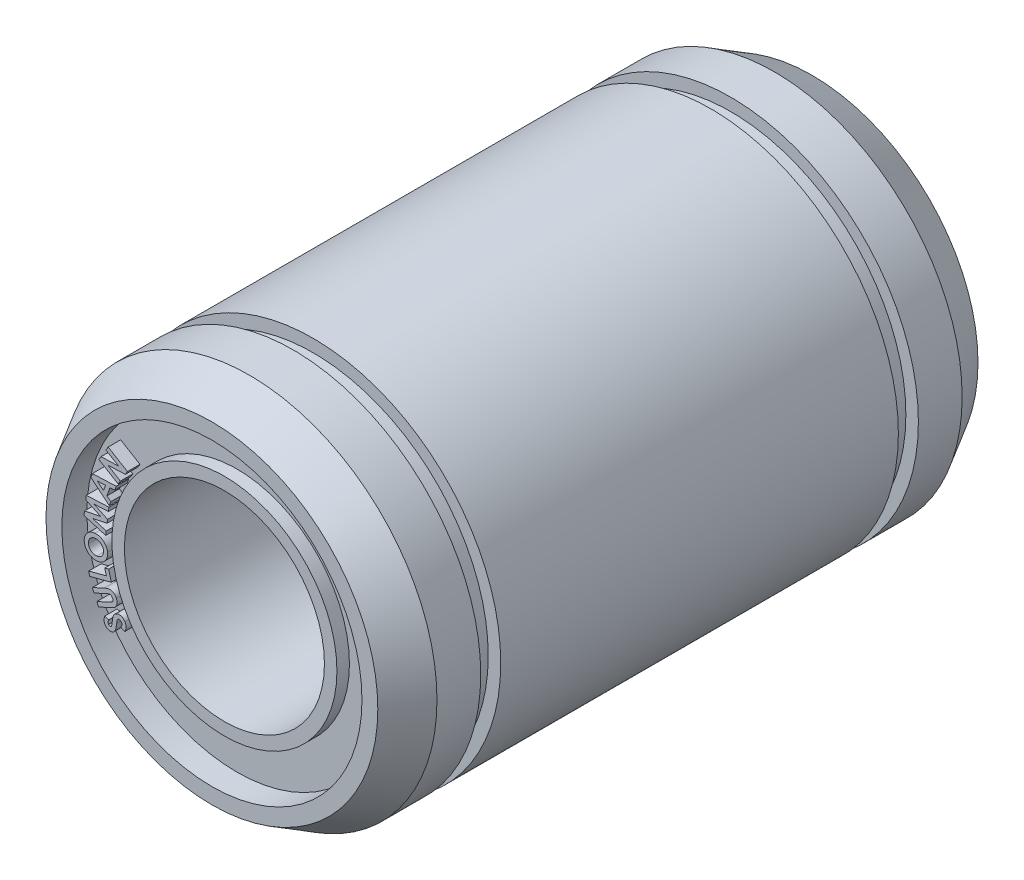
from build123d import *

# Parameters (mm, degrees)
SKETCH1_R                = 7.5
SKETCH1_R_2              = 6
BOSS_EXTRUDE1_DEPTH      = 12
CHAMFER2_SIZE            = 1.5
CHAMFER2_SIZE2           = 0.866025404
BOSS_EXTRUDE2_DEPTH      = 11
BOSS_EXTRUDE2_DEPTH_BACK = 11
SKETCH5_R                = 6
SKETCH5_R_2              = 4
SKETCH6_R                = 4.5
SKETCH6_R_2              = 4
BOSS_EXTRUDE3_DEPTH      = 0.5
SKETCH7_W                = 0.8
SKETCH7_H                = 0.5
BOSS_EXTRUDE4_DEPTH      = 0.5
CHAMFER3_SIZE            = 1.5
CHAMFER3_SIZE2           = 0.866025404


with BuildPart() as part:
    # Sketch1 → Boss-Extrude1 (new, symmetric)
    with BuildSketch(Plane.XY):
        Circle(SKETCH1_R)
        Circle(SKETCH1_R_2, mode=Mode.SUBTRACT)
    extrude(amount=BOSS_EXTRUDE1_DEPTH, both=True)

    # Chamfer2
    chamfer2_edges = [part.edges().sort_by_distance(p)[0] for p in [
        (-7.5, 0, 12),
    ]]
    chamfer2_side = [part.faces().sort_by_distance(p)[0] for p in [
        (-7.5, 0, 0),
    ]]
    chamfer(chamfer2_edges, length=CHAMFER2_SIZE, length2=CHAMFER2_SIZE2, reference=chamfer2_side[0])



with BuildPart() as body_2:
    # Sketch5 → Boss-Extrude2 (new, two sides: drawn at the far end of the back side and taken through both)
    with BuildSketch(Plane.XY.offset(-BOSS_EXTRUDE2_DEPTH_BACK)):
        Circle(SKETCH5_R)
        Circle(SKETCH5_R_2, mode=Mode.SUBTRACT)
    extrude(amount=BOSS_EXTRUDE2_DEPTH + BOSS_EXTRUDE2_DEPTH_BACK)


with BuildPart() as part_1:
    add(part.part)

    add(body_2.part)  # Boss-Extrude3 merges body 2
    # Sketch6 → Boss-Extrude3 (add)
    with BuildSketch(Plane.XY.offset(11)):
        Circle(SKETCH6_R)
        Circle(SKETCH6_R_2, mode=Mode.SUBTRACT)
    boss_extrude3 = extrude(amount=BOSS_EXTRUDE3_DEPTH)

    # Mirror1: Boss-Extrude3 across plane
    add(boss_extrude3.mirror(Plane.XY))

    # Sketch7 → Cut-Revolve1 (revolve, cut)
    with BuildSketch(Plane(origin=(0, 0, 0), x_dir=(0, 0, -1), z_dir=(1, 0, 0))):
        with Locations((-8.35, 7.25)):
            Rectangle(SKETCH7_W, SKETCH7_H)
        with Locations((8.35, 7.25)):
            Rectangle(SKETCH7_W, SKETCH7_H)
    revolve(axis=Axis((0, 0, 0), (0, 0, -1)), mode=Mode.SUBTRACT)

    # Sketch8 → Boss-Extrude4 (add)
    # profile 1 of 7: a face of its own
    with BuildSketch(Plane.XY.offset(11)):
        Polygon((-5.019213926, 2.56696334), (-4.934838926, 2.707408052), (-4.229009599, 2.73336959), (-4.736161041, 3.03805709), (-4.647819695, 3.184811898), (-3.877086522, 2.72165084), (-3.961822099, 2.580665263), (-4.666028829, 2.554523436), (-4.160319695, 2.25055709), (-4.248480752, 2.103802283), align=None)
    # profile 2 of 7: a face of its own
    with BuildSketch(Plane.XY.offset(11)):
        Polygon((-5.335912282, 1.78586355), (-5.281104589, 1.949024608), (-4.326296897, 1.9897698), (-4.382546897, 1.822462108), (-4.578881032, 1.815070281), (-4.694986801, 1.470178454), (-4.54390507, 1.342714512), (-4.600335359, 1.175406819), align=None)
        Polygon((-5.084049301, 1.793255377), (-4.831645455, 1.582858742), (-4.756104589, 1.807498166), align=None, mode=Mode.SUBTRACT)
    # profile 3 of 7: a face of its own
    with BuildSketch(Plane.XY.offset(11)):
        Polygon((-5.614467681, 0.334474611), (-5.594455662, 0.499618842), (-4.951006143, 0.629787111), (-5.544515758, 0.912479419), (-5.524684028, 1.0752799), (-4.619816239, 1.1174674), (-4.639467681, 0.954666919), (-5.210982104, 0.927263073), (-4.673902778, 0.670892881), (-4.691931624, 0.521974611), (-5.274443643, 0.403344804), (-4.726186431, 0.23856115), (-4.746018162, 0.073957785), align=None)
    # profile 4 of 7: a face of its own
    with BuildSketch(Plane.XY.offset(11)):
        with BuildLine():
            add(Edge.make_bspline(
                [(-5.603687751, -0.569841462), (-5.604771213, -0.554405134), (-5.606912505, -0.523897658), (-5.604836323, -0.478508597), (-5.59828654, -0.434375331), (-5.587500583, -0.391434334), (-5.572018329, -0.349792704), (-5.552227666, -0.309321337), (-5.527970554, -0.270163036), (-5.499603183, -0.232735486), (-5.46801183, -0.197899174), (-5.433869548, -0.166445264), (-5.39720005, -0.139279288), (-5.358297061, -0.116022804), (-5.316953038, -0.097101922), (-5.27344981, -0.082048667), (-5.227654972, -0.071116249), (-5.196164785, -0.067200484), (-5.180190155, -0.065214058)],
                knots=[0, 0, 0, 0, 1.013293411, 2.002615178, 2.969929983, 3.932617152, 4.898167076, 5.875568108, 6.879846568, 7.911542323, 8.948552327, 9.957490501, 10.948237499, 11.933530897, 12.921966733, 13.921943731, 14.945824639, 16, 16, 16, 16], degree=3))
            add(Edge.make_bspline(
                [(-5.180190155, -0.065214058), (-5.164273478, -0.064064367), (-5.132930459, -0.061800403), (-5.086362342, -0.063759752), (-5.04126119, -0.069851147), (-4.997576001, -0.080239792), (-4.955530926, -0.095487507), (-4.914737099, -0.114512303), (-4.875636997, -0.138461127), (-4.838306799, -0.166172433), (-4.803561242, -0.197027873), (-4.772554477, -0.230566202), (-4.745498007, -0.266182305), (-4.722630215, -0.304154469), (-4.703816933, -0.344353118), (-4.689061103, -0.386768614), (-4.677976192, -0.431298182), (-4.674221861, -0.46197409), (-4.672317559, -0.47753377)],
                knots=[0, 0, 0, 0, 1.051083948, 2.069787806, 3.065186475, 4.047001297, 5.02295037, 6.008083167, 7.00866935, 8.039292488, 9.068841912, 10.066672639, 11.045005907, 12.011619095, 12.982628744, 13.964723154, 14.967650608, 16, 16, 16, 16], degree=3))
            add(Edge.make_bspline(
                [(-4.672317559, -0.47753377), (-4.671174586, -0.493870455), (-4.668931316, -0.525933852), (-4.670769912, -0.573546861), (-4.677277083, -0.619372172), (-4.688096233, -0.663651894), (-4.703679977, -0.706136439), (-4.723860037, -0.746959035), (-4.748544058, -0.786081785), (-4.777419269, -0.823037218), (-4.80937336, -0.857226715), (-4.843868735, -0.887740214), (-4.88035879, -0.914362069), (-4.918952156, -0.936996103), (-4.959495616, -0.955734288), (-5.002160222, -0.970036057), (-5.046713009, -0.980983345), (-5.077372214, -0.984754616), (-5.092930539, -0.986668385)],
                knots=[0, 0, 0, 0, 1.067921877, 2.095970056, 3.101855708, 4.083271722, 5.064468398, 6.04820796, 7.049037107, 8.077279679, 9.103666541, 10.098115712, 11.077681476, 12.046047685, 13.012753385, 13.986115716, 14.978033957, 16, 16, 16, 16], degree=3))
            add(Edge.make_bspline(
                [(-5.092930539, -0.986668385), (-5.103440225, -0.987549711), (-5.124315146, -0.989300249), (-5.155518994, -0.989084084), (-5.186291796, -0.98739402), (-5.216584291, -0.983569235), (-5.246438089, -0.977877368), (-5.27570031, -0.969780851), (-5.304639777, -0.96008789), (-5.333006568, -0.948400159), (-5.360531237, -0.934916184), (-5.386927267, -0.919758882), (-5.411982678, -0.90293231), (-5.435907526, -0.8847182), (-5.458469147, -0.864750233), (-5.479995132, -0.84338628), (-5.499940642, -0.820123157), (-5.518906818, -0.795761388), (-5.536062918, -0.770115503), (-5.551506137, -0.743637034), (-5.565063126, -0.716437945), (-5.576530972, -0.688431306), (-5.586401303, -0.659880537), (-5.594084129, -0.630511219), (-5.600166523, -0.600485556), (-5.60251129, -0.580079819), (-5.603687751, -0.569841462)],
                knots=[0, 0, 0, 0, 1.035459586, 2.056687238, 3.061940431, 4.061370555, 5.053522074, 6.044461155, 7.041290387, 8.049813999, 9.055656306, 10.04996546, 11.037205352, 12.018337724, 13.001244298, 13.994676931, 14.994804129, 16.009047072, 17.025760685, 18.023026782, 19.018281714, 20.008182895, 20.993833169, 21.983241407, 22.988113225, 24, 24, 24, 24], degree=3))
        make_face()
        with BuildLine():
            add(Edge.make_bspline(
                [(-5.438363232, -0.555418385), (-5.437109991, -0.56542628), (-5.434635251, -0.585188591), (-5.427702433, -0.613871064), (-5.418345203, -0.641069143), (-5.406333875, -0.666765442), (-5.391693108, -0.690881294), (-5.374628984, -0.713670472), (-5.354831507, -0.73477848), (-5.332804641, -0.754270174), (-5.309004915, -0.771782064), (-5.283518565, -0.786370216), (-5.257066622, -0.798642664), (-5.229157567, -0.807540183), (-5.200229098, -0.814186762), (-5.17001231, -0.817634244), (-5.138634587, -0.8186527), (-5.117443874, -0.817092034), (-5.106632462, -0.816295789)],
                knots=[0, 0, 0, 0, 1.025341516, 2.024713326, 2.995229938, 3.946946593, 4.904144855, 5.86024931, 6.837787205, 7.84247362, 8.848795365, 9.837565654, 10.825144666, 11.809141188, 12.811705142, 13.839903807, 14.897928127, 16, 16, 16, 16], degree=3))
            add(Edge.make_bspline(
                [(-5.106632462, -0.816295789), (-5.094688186, -0.814876318), (-5.071357327, -0.812103652), (-5.037791139, -0.803591024), (-5.006435982, -0.79230769), (-4.97728422, -0.777790978), (-4.950457703, -0.759978865), (-4.925825447, -0.739127438), (-4.903370801, -0.715235806), (-4.890736526, -0.697230872), (-4.884336789, -0.688110693)],
                knots=[0, 0, 0, 0, 1.084699738, 2.118753527, 3.117445896, 4.087776396, 5.050618586, 6.016709792, 6.995388641, 8, 8, 8, 8], degree=3))
            add(Edge.make_bspline(
                [(-4.884336789, -0.688110693), (-4.879633984, -0.680737899), (-4.87030368, -0.666110374), (-4.858832239, -0.643017012), (-4.849614103, -0.619390583), (-4.842285505, -0.595305786), (-4.83729953, -0.570611441), (-4.834330005, -0.545346552), (-4.833832575, -0.519573391), (-4.835047054, -0.502287849), (-4.835658905, -0.493579443)],
                knots=[0, 0, 0, 0, 1.0250378, 2.03366143, 3.017882375, 3.996738852, 4.982271152, 5.968408103, 6.976489846, 8, 8, 8, 8], degree=3))
            add(Edge.make_bspline(
                [(-4.835658905, -0.493579443), (-4.836906654, -0.483749988), (-4.839363019, -0.464399361), (-4.84634976, -0.436327726), (-4.855726822, -0.40959654), (-4.867830046, -0.384235765), (-4.882745446, -0.360417589), (-4.899997546, -0.337834817), (-4.919916871, -0.316674105), (-4.942360253, -0.297249768), (-4.966398736, -0.27966293), (-4.991804807, -0.264820492), (-5.018151751, -0.252584925), (-5.045580114, -0.243199032), (-5.074056147, -0.236719433), (-5.103450437, -0.232969313), (-5.133885289, -0.231742621), (-5.154415335, -0.233334196), (-5.164865636, -0.234144347)],
                knots=[0, 0, 0, 0, 1.017887162, 2.003850259, 2.967177827, 3.926057472, 4.886110667, 5.851180024, 6.843317752, 7.867950975, 8.898582717, 9.900958706, 10.887792445, 11.880295583, 12.875429553, 13.88465529, 14.923237292, 16, 16, 16, 16], degree=3))
            add(Edge.make_bspline(
                [(-5.164865636, -0.234144347), (-5.175177538, -0.235378278), (-5.195556346, -0.237816824), (-5.225083961, -0.245034804), (-5.253250277, -0.254364368), (-5.279929347, -0.266311679), (-5.305069751, -0.280944867), (-5.328571474, -0.298307051), (-5.350953649, -0.317737921), (-5.371205801, -0.339857601), (-5.389570042, -0.363408286), (-5.405114325, -0.388281309), (-5.418110238, -0.413903596), (-5.427789943, -0.440644009), (-5.43493097, -0.468100528), (-5.438973689, -0.496508494), (-5.440644379, -0.525747181), (-5.439129834, -0.545447083), (-5.438363232, -0.555418385)],
                knots=[0, 0, 0, 0, 1.060114784, 2.095042534, 3.098761831, 4.088032384, 5.075720515, 6.064228771, 7.069149004, 8.098745803, 9.122891904, 10.115965163, 11.090650134, 12.052097306, 13.015502621, 13.983591319, 14.979374611, 16, 16, 16, 16], degree=3))
        make_face(mode=Mode.SUBTRACT)
    # profile 5 of 7: a face of its own
    with BuildSketch(Plane.XY.offset(11)):
        Polygon((-5.383854115, -1.663157535), (-5.427303634, -1.499095035), (-4.721834884, -1.312496478), (-4.784935845, -1.073433978), (-4.628445461, -1.03214792), (-4.52189498, -1.43527292), align=None)
    # profile 6 of 7: a face of its own
    with BuildSketch(Plane.XY.offset(11)):
        with BuildLine():
            Line((-5.029590563, -2.546195895), (-5.100443928, -2.391147818))
            Line((-5.100443928, -2.391147818), (-4.574722774, -2.150462722))
            add(Edge.make_bspline(
                [(-4.574722774, -2.150462722), (-4.569289345, -2.14798951), (-4.558815687, -2.143222064), (-4.544090686, -2.135519821), (-4.530538579, -2.128410599), (-4.518464239, -2.121442429), (-4.507915492, -2.114515858), (-4.498709107, -2.107843794), (-4.490730338, -2.101500307), (-4.482300342, -2.0929924), (-4.473670766, -2.081933851), (-4.465519588, -2.067443444), (-4.459986373, -2.051630492), (-4.456716618, -2.034751077), (-4.455995341, -2.016996539), (-4.458107291, -1.998623412), (-4.462731902, -1.979697891), (-4.467987538, -1.967464842), (-4.470696332, -1.961159838)],
                knots=[0, 0, 0, 0, 1.148435637, 2.213762344, 3.196639077, 4.093071106, 4.894864287, 5.623441161, 6.280820129, 6.853172085, 7.924131837, 8.969759653, 10.037718811, 11.13305885, 12.267201454, 13.441996364, 14.681586003, 16, 16, 16, 16], degree=3))
            add(Edge.make_bspline(
                [(-4.470696332, -1.961159838), (-4.473890538, -1.95469186), (-4.480123247, -1.942071191), (-4.492098763, -1.925246038), (-4.505810309, -1.910872592), (-4.521146625, -1.899303698), (-4.537241816, -1.889955077), (-4.554057683, -1.883841791), (-4.570990888, -1.880226525), (-4.585535255, -1.879900735), (-4.59784385, -1.88147979), (-4.608665652, -1.883394285), (-4.620897398, -1.88679119), (-4.634696832, -1.89110109), (-4.649886807, -1.896802704), (-4.666740523, -1.903203935), (-4.684899778, -1.911038549), (-4.697448724, -1.916727989), (-4.703989601, -1.919693491)],
                knots=[0, 0, 0, 0, 1.260702351, 2.459950721, 3.597876305, 4.723146205, 5.810989002, 6.842423124, 7.840620339, 8.829355756, 9.369374735, 10.01085573, 10.750578187, 11.588703975, 12.540162428, 13.588874705, 14.743251218, 16, 16, 16, 16], degree=3))
            Line((-4.703989601, -1.919693491), (-5.210239601, -2.151364164))
            Line((-5.210239601, -2.151364164), (-5.281092966, -1.996316088))
            Line((-5.281092966, -1.996316088), (-4.796838159, -1.774741568))
            add(Edge.make_bspline(
                [(-4.796838159, -1.774741568), (-4.787002199, -1.770249768), (-4.768128833, -1.761630844), (-4.740677324, -1.749947873), (-4.715400016, -1.739603126), (-4.692278559, -1.730757846), (-4.671277581, -1.723537479), (-4.652512807, -1.717611222), (-4.635814656, -1.713492866), (-4.616343886, -1.70975109), (-4.592843087, -1.707807506), (-4.564301657, -1.709017842), (-4.534741135, -1.713382083), (-4.504723222, -1.721175851), (-4.475068978, -1.731520901), (-4.447124313, -1.745057493), (-4.421529611, -1.761689769), (-4.397828861, -1.780907568), (-4.376210682, -1.803344675), (-4.356570675, -1.829023034), (-4.338324758, -1.857779444), (-4.328235933, -1.878773275), (-4.323040082, -1.889585318)],
                knots=[0, 0, 0, 0, 1.156467227, 2.219044284, 3.19063233, 4.077593984, 4.866278595, 5.565676642, 6.181452405, 6.704620806, 7.685182106, 8.695051312, 9.754045282, 10.874919227, 12.007289428, 13.108286134, 14.186935546, 15.265086923, 16.365126346, 17.510645842, 18.717956423, 20, 20, 20, 20], degree=3))
            add(Edge.make_bspline(
                [(-4.323040082, -1.889585318), (-4.319801328, -1.896871672), (-4.313434639, -1.911195066), (-4.305953035, -1.933203542), (-4.299750607, -1.954962501), (-4.295207261, -1.976652085), (-4.292385042, -1.998169052), (-4.290778888, -2.019549108), (-4.291283555, -2.040824036), (-4.293001205, -2.061854624), (-4.296324324, -2.082301885), (-4.300584096, -2.102084919), (-4.306191241, -2.120920755), (-4.312821006, -2.139016438), (-4.321041422, -2.156007237), (-4.329987345, -2.172392), (-4.340326118, -2.187761082), (-4.352126497, -2.202486529), (-4.365896988, -2.217076315), (-4.382697228, -2.23143878), (-4.402398465, -2.246142353), (-4.425048855, -2.261363324), (-4.450835444, -2.276714937), (-4.479570666, -2.292596523), (-4.511280755, -2.308851729), (-4.533698655, -2.319232653), (-4.545335755, -2.324621376)],
                knots=[0, 0, 0, 0, 1.021687439, 2.008416554, 2.976688021, 3.921003407, 4.846015211, 5.757160507, 6.666349574, 7.570990458, 8.460113649, 9.319951496, 10.163377453, 10.977587415, 11.787412014, 12.580575583, 13.369010973, 14.15827396, 14.99746724, 15.936709606, 16.987520732, 18.147742274, 19.433275887, 20.833286212, 22.356163382, 24, 24, 24, 24], degree=3))
            Line((-4.545335755, -2.324621376), (-5.029590563, -2.546195895))
        make_face()
    # profile 7 of 7: a face of its own
    with BuildSketch(Plane.XY.offset(11)):
        with BuildLine():
            Line((-4.787625882, -2.738342648), (-4.626808575, -2.785037359))
            add(Edge.make_bspline(
                [(-4.626808575, -2.785037359), (-4.630039746, -2.793532567), (-4.636232402, -2.809813939), (-4.64347801, -2.833912043), (-4.647777727, -2.856649193), (-4.649858399, -2.877890845), (-4.649719139, -2.897731914), (-4.646561965, -2.916038457), (-4.64127534, -2.93306829), (-4.635586786, -2.943173498), (-4.632758094, -2.948198417)],
                knots=[0, 0, 0, 0, 1.287646441, 2.467820929, 3.559995072, 4.560638573, 5.488925283, 6.361033311, 7.185006807, 8, 8, 8, 8], degree=3))
            add(Edge.make_bspline(
                [(-4.632758094, -2.948198417), (-4.62969369, -2.952559671), (-4.623792319, -2.960958489), (-4.613215622, -2.971687116), (-4.601362692, -2.979713783), (-4.588725544, -2.985116997), (-4.576059039, -2.988014657), (-4.563988161, -2.988488022), (-4.55270236, -2.986423754), (-4.546210831, -2.982932027), (-4.54297444, -2.981191205)],
                knots=[0, 0, 0, 0, 1.209333939, 2.328912064, 3.400275986, 4.439778179, 5.433183311, 6.334452776, 7.169631329, 8, 8, 8, 8], degree=3))
            add(Edge.make_bspline(
                [(-4.54297444, -2.981191205), (-4.539931765, -2.979080792), (-4.533802346, -2.974829399), (-4.526330581, -2.966310157), (-4.519811242, -2.956663669), (-4.516771723, -2.949404263), (-4.515210017, -2.945674378)],
                knots=[0, 0, 0, 0, 0.965706043, 1.94539934, 2.94434582, 4, 4, 4, 4], degree=3))
            add(Edge.make_bspline(
                [(-4.515210017, -2.945674378), (-4.514147421, -2.94250127), (-4.511686487, -2.935152464), (-4.508626269, -2.922343641), (-4.50514618, -2.906365992), (-4.501689771, -2.887150605), (-4.497638974, -2.864759776), (-4.493548222, -2.839146511), (-4.489215751, -2.81029991), (-4.486402262, -2.789968381), (-4.484921555, -2.779268128)],
                knots=[0, 0, 0, 0, 0.474147896, 1.09810967, 1.865028906, 2.792315478, 3.86513017, 5.090549847, 6.468789568, 8, 8, 8, 8], degree=3))
            add(Edge.make_bspline(
                [(-4.484921555, -2.779268128), (-4.483543698, -2.769291569), (-4.480928684, -2.750357218), (-4.477150431, -2.72349295), (-4.473709848, -2.699697127), (-4.470704208, -2.678885147), (-4.467800185, -2.661107889), (-4.465288031, -2.646322082), (-4.463179715, -2.634590412), (-4.461737628, -2.627823196), (-4.461123479, -2.624941205)],
                knots=[0, 0, 0, 0, 1.547656545, 2.937272422, 4.168857191, 5.242424632, 6.168553879, 6.936782392, 7.547201889, 8, 8, 8, 8], degree=3))
            add(Edge.make_bspline(
                [(-4.461123479, -2.624941205), (-4.458298319, -2.613592032), (-4.452873573, -2.591799853), (-4.442220097, -2.561289002), (-4.430123243, -2.534190823), (-4.416532304, -2.5100363), (-4.400526884, -2.48871582), (-4.382514412, -2.469211495), (-4.362143587, -2.451470655), (-4.347055137, -2.441313209), (-4.339428767, -2.436179186)],
                knots=[0, 0, 0, 0, 1.214063191, 2.331190279, 3.350760311, 4.292816532, 5.202738135, 6.112488508, 7.045968226, 8, 8, 8, 8], degree=3))
            add(Edge.make_bspline(
                [(-4.339428767, -2.436179186), (-4.331765282, -2.431566124), (-4.316698264, -2.422496479), (-4.292869746, -2.411920052), (-4.268935023, -2.403732464), (-4.244704284, -2.398214404), (-4.220210568, -2.395567277), (-4.195437121, -2.395339125), (-4.170408316, -2.397896218), (-4.145458135, -2.40322905), (-4.120795223, -2.410632429), (-4.097110067, -2.42086665), (-4.074421714, -2.4332733), (-4.053088434, -2.448425069), (-4.032815468, -2.465811125), (-4.013635442, -2.48560396), (-3.995532081, -2.507765105), (-3.984841243, -2.523999272), (-3.979392709, -2.532272936)],
                knots=[0, 0, 0, 0, 1.026385115, 2.017954532, 2.986978708, 3.927947565, 4.865391754, 5.810930593, 6.768234365, 7.748207209, 8.737155171, 9.720403376, 10.705804938, 11.701473004, 12.719540757, 13.768872892, 14.862917019, 16, 16, 16, 16], degree=3))
            add(Edge.make_bspline(
                [(-3.979392709, -2.532272936), (-3.975335985, -2.538952031), (-3.967329814, -2.552133597), (-3.957064358, -2.572494822), (-3.948562385, -2.593078158), (-3.941441548, -2.613687431), (-3.936325653, -2.634537339), (-3.932346018, -2.655396193), (-3.930464316, -2.676463277), (-3.930092306, -2.697671677), (-3.931312542, -2.719085231), (-3.934526669, -2.740808474), (-3.939068368, -2.762986114), (-3.945932471, -2.785377069), (-3.954242987, -2.808122109), (-3.964143884, -2.831309439), (-3.976115677, -2.854701333), (-3.985090766, -2.870173513), (-3.989669152, -2.878066205)],
                knots=[0, 0, 0, 0, 1.02160864, 2.016201527, 2.977964644, 3.932250132, 4.864272877, 5.782947909, 6.706450342, 7.626032442, 8.554968956, 9.507408284, 10.495366222, 11.512279178, 12.566377024, 13.661197181, 14.806926365, 16, 16, 16, 16], degree=3))
            Line((-3.989669152, -2.878066205), (-4.138587421, -2.803607071))
            add(Edge.make_bspline(
                [(-4.138587421, -2.803607071), (-4.133582755, -2.794120167), (-4.124015159, -2.775983723), (-4.112417229, -2.748830444), (-4.104574859, -2.722946313), (-4.100083712, -2.698503155), (-4.0990417, -2.675478579), (-4.101522805, -2.653838261), (-4.107572116, -2.633551687), (-4.114322294, -2.621413092), (-4.117673959, -2.615385917)],
                knots=[0, 0, 0, 0, 1.294139108, 2.474050948, 3.55701427, 4.551437514, 5.4659571, 6.327740533, 7.16967329, 8, 8, 8, 8], degree=3))
            add(Edge.make_bspline(
                [(-4.117673959, -2.615385917), (-4.121691377, -2.609583258), (-4.129466434, -2.59835316), (-4.144006382, -2.584398133), (-4.160307907, -2.573666448), (-4.178043275, -2.566720909), (-4.195877507, -2.562515528), (-4.213205131, -2.562314793), (-4.229610565, -2.56561335), (-4.239227245, -2.570782876), (-4.244056171, -2.573378705)],
                knots=[0, 0, 0, 0, 1.147541826, 2.220879599, 3.261013292, 4.306479152, 5.309019566, 6.229449662, 7.110934592, 8, 8, 8, 8], degree=3))
            add(Edge.make_bspline(
                [(-4.244056171, -2.573378705), (-4.248208864, -2.576358894), (-4.256590621, -2.582374079), (-4.267152451, -2.594397336), (-4.276392611, -2.608502711), (-4.282586099, -2.622292125), (-4.287124428, -2.635033274), (-4.290185534, -2.646852154), (-4.293768302, -2.660420715), (-4.29662375, -2.676136667), (-4.300004924, -2.693699469), (-4.302929776, -2.713328725), (-4.306060093, -2.734894462), (-4.307963476, -2.74993771), (-4.308960017, -2.757813802)],
                knots=[0, 0, 0, 0, 0.910679941, 1.838107835, 2.83878883, 3.914970798, 4.529650626, 5.253867616, 6.095047352, 7.03635736, 8.10625351, 9.29081069, 10.58156821, 12, 12, 12, 12], degree=3))
            add(Edge.make_bspline(
                [(-4.308960017, -2.757813802), (-4.310812684, -2.772787344), (-4.314366538, -2.801510134), (-4.320603495, -2.842719534), (-4.326771342, -2.880322426), (-4.333411112, -2.914301646), (-4.340442989, -2.944593979), (-4.347547504, -2.97134736), (-4.355021185, -2.994505787), (-4.363071849, -3.014349791), (-4.371673121, -3.031786928), (-4.380585477, -3.047808743), (-4.390319652, -3.062657231), (-4.400916787, -3.076240393), (-4.411974689, -3.088915497), (-4.423986676, -3.100220374), (-4.436434696, -3.110725381), (-4.445435713, -3.116672828), (-4.449945594, -3.119652744)],
                knots=[0, 0, 0, 0, 1.804438292, 3.461338615, 4.984471496, 6.361666836, 7.60129831, 8.703234628, 9.671512468, 10.50972676, 11.261925021, 11.995661829, 12.70136834, 13.382829797, 14.0549403, 14.710749838, 15.354032529, 16, 16, 16, 16], degree=3))
            add(Edge.make_bspline(
                [(-4.449945594, -3.119652744), (-4.456484382, -3.123514053), (-4.46942205, -3.131154053), (-4.489866374, -3.140130029), (-4.510753734, -3.146909928), (-4.532164422, -3.151244571), (-4.554050445, -3.153237347), (-4.576395278, -3.152784923), (-4.599224145, -3.150277561), (-4.622263931, -3.1453797), (-4.645031358, -3.138513513), (-4.666694142, -3.129203128), (-4.687250574, -3.118162643), (-4.706598023, -3.105147757), (-4.724783791, -3.090051079), (-4.741636783, -3.072873982), (-4.757518598, -3.053904406), (-4.766722452, -3.040000212), (-4.771399921, -3.032933994)],
                knots=[0, 0, 0, 0, 0.982813431, 1.944597851, 2.884883073, 3.822135214, 4.767817035, 5.725308598, 6.712059204, 7.737882008, 8.771939761, 9.786808029, 10.786307958, 11.790132325, 12.801652171, 13.841872472, 14.903223031, 16, 16, 16, 16], degree=3))
            add(Edge.make_bspline(
                [(-4.771399921, -3.032933994), (-4.777007582, -3.023450382), (-4.788166327, -3.004578842), (-4.800293375, -2.973908669), (-4.80904981, -2.942063658), (-4.81313028, -2.914366124), (-4.814369578, -2.891237454), (-4.813905684, -2.872632028), (-4.812446195, -2.852959356), (-4.80990811, -2.832135447), (-4.8061329, -2.810230667), (-4.800950353, -2.787239061), (-4.79487905, -2.763113202), (-4.790085018, -2.74674093), (-4.787625882, -2.738342648)],
                knots=[0, 0, 0, 0, 1.29640846, 2.57973696, 3.871476734, 5.181293919, 5.869045044, 6.598506678, 7.372391716, 8.192697571, 9.06926154, 9.990121729, 10.969017476, 12, 12, 12, 12], degree=3))
        make_face()
    extrude(amount=BOSS_EXTRUDE4_DEPTH)

    # Chamfer3
    chamfer3_edges = [part_1.edges().sort_by_distance(p)[0] for p in [
        (-7.5, 0, -12),
    ]]
    chamfer3_side = [part_1.faces().sort_by_distance(p)[0] for p in [
        (-7.5, 0, -10.375),
    ]]
    chamfer(chamfer3_edges, length=CHAMFER3_SIZE, length2=CHAMFER3_SIZE2, reference=chamfer3_side[0])


solid = part_1.part
